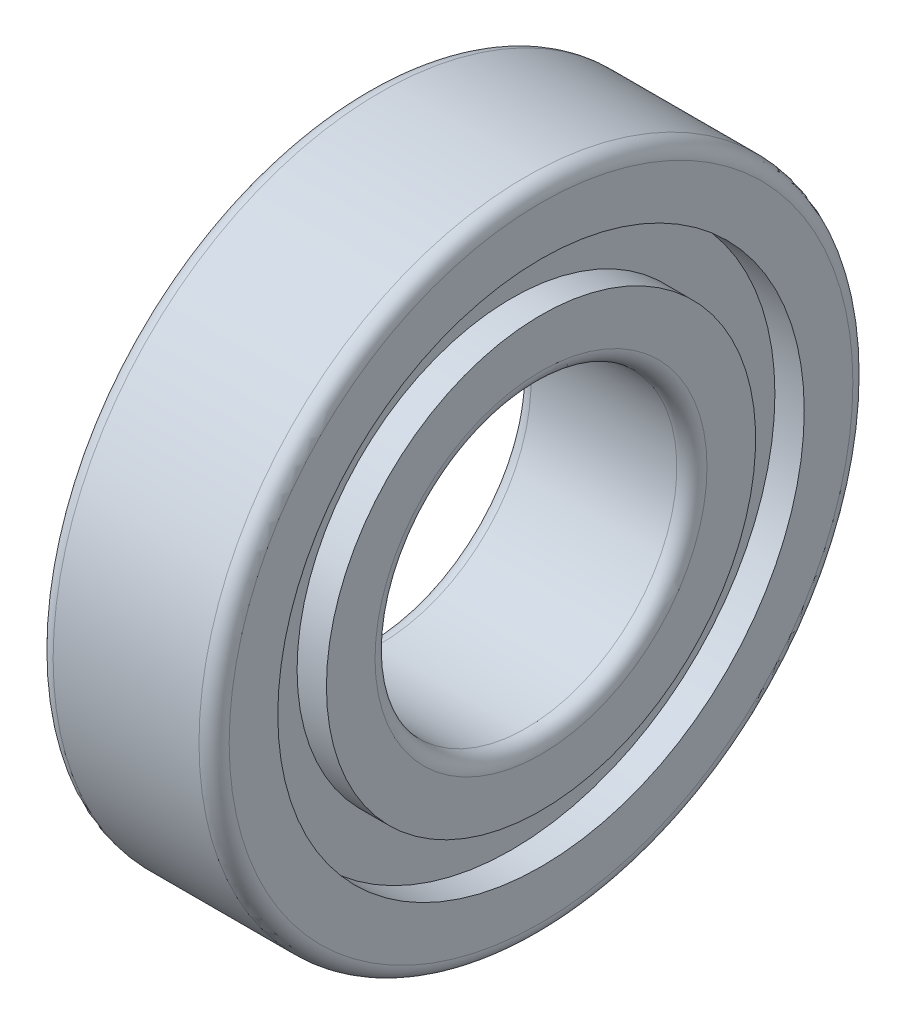
from build123d import *


with BuildPart() as part:
    # Эскиз1 → Повернуть1 (revolve)
    with BuildSketch(Plane.XY):
        with BuildLine():
            Line((1.45, 3), (-1.45, 3))
            ThreePointArc((-1.45, 3), (-1.662132034, 3.087867966), (-1.75, 3.3))
            Line((-1.75, 3.3), (-1.75, 4.266666667))
            Line((-1.75, 4.266666667), (-1.166666667, 4.266666667))
            Line((-1.166666667, 4.266666667), (-1.166666667, 5.233333333))
            Line((-1.166666667, 5.233333333), (-1.75, 5.233333333))
            Line((-1.75, 5.233333333), (-1.75, 6.2))
            ThreePointArc((-1.75, 6.2), (-1.662132034, 6.412132034), (-1.45, 6.5))
            Line((-1.45, 6.5), (1.45, 6.5))
            ThreePointArc((1.45, 6.5), (1.662132034, 6.412132034), (1.75, 6.2))
            Line((1.75, 6.2), (1.75, 5.233333333))
            Line((1.75, 5.233333333), (1.166666667, 5.233333333))
            Line((1.166666667, 5.233333333), (1.166666667, 4.266666667))
            Line((1.166666667, 4.266666667), (1.75, 4.266666667))
            Line((1.75, 4.266666667), (1.75, 3.3))
            ThreePointArc((1.75, 3.3), (1.662132034, 3.087867966), (1.45, 3))
        make_face()
    revolve(axis=Axis((-1000, 0, 0), (1, 0, 0)))


solid = part.part
